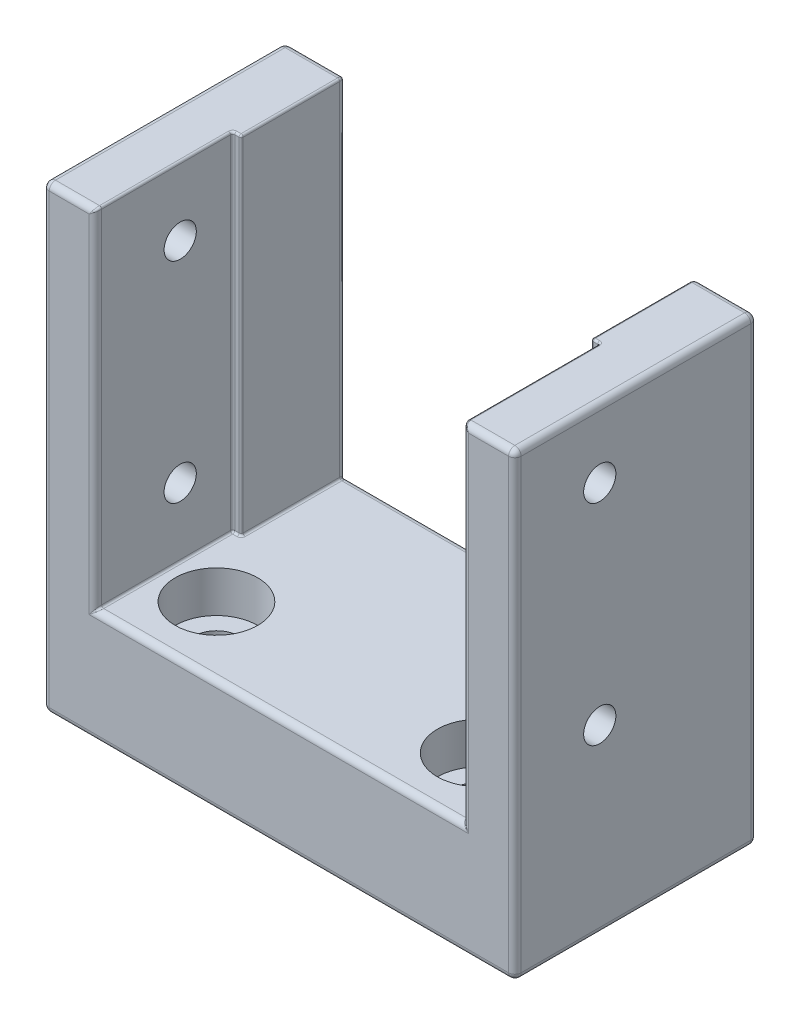
from build123d import *

# Parameters (mm, degrees)
SKETCH1_W                      = 44.45000000000001
SKETCH1_H                      = 29.325011200000002
BOSS_EXTRUDE1_DEPTH            = 13.685012
SKETCH2_W                      = 29.325011200000002
SKETCH2_H                      = 55.6850042
BOSS_EXTRUDE2_DEPTH            = 6.35
M3_5_CLEARANCE_HOLE1_D         = 3.9
SKETCH8_W                      = 12.7
SKETCH8_H                      = 41.9999922
BOSS_EXTRUDE6_DEPTH            = 1.0249910919999998
CBORE_FOR_M5_SHCS1_D           = 5.5
CBORE_FOR_M5_SHCS1_CBORE_D     = 10
CBORE_FOR_M5_SHCS1_CBORE_DEPTH = 5
FILLET1_R                      = 0.762
FILLET2_R                      = 0.254


with BuildPart() as part:
    # Sketch1 → Boss-Extrude1 (new body)
    with BuildSketch(Plane(origin=(0, 0, 0), x_dir=(1, 0, 0), z_dir=(0, 1, 0))):
        Rectangle(SKETCH1_W, SKETCH1_H)
    extrude(amount=-BOSS_EXTRUDE1_DEPTH)

    # Sketch2 → Boss-Extrude2 (add)
    with BuildSketch(Plane(origin=(22.225000000000005, 0, 0), x_dir=(0, 0, -1), z_dir=(1, 0, 0))):
        with Locations((0, 14.1574901)):
            Rectangle(SKETCH2_W, SKETCH2_H)
    boss_extrude2 = extrude(amount=BOSS_EXTRUDE2_DEPTH)

    # M3.5 Clearance Hole1 (through all)
    with Locations(Plane(origin=(28.575000000000003, 0, 0), x_dir=(0, 0, -1), z_dir=(1, 0, 0))):
        with Locations((-4.3874944, 33.7), (-4.3874944, 8.3)):
            m3_5_clearance_hole1 = Hole(M3_5_CLEARANCE_HOLE1_D / 2)

    # Mirror1: Boss-Extrude2, M3.5 Clearance Hole1 across plane
    add(boss_extrude2.mirror(Plane(origin=(0, 0, 0), x_dir=(0, 0, 1), z_dir=(1, 0, 0))))
    add(m3_5_clearance_hole1.mirror(Plane(origin=(0, 0, 0), x_dir=(0, 0, 1), z_dir=(1, 0, 0))), mode=Mode.SUBTRACT)

    # Sketch8 → Boss-Extrude6 (add)
    with BuildSketch(Plane.ZY.offset(-22.225000000000005)):
        with Locations((-8.312505600000001, 20.9999961)):
            Rectangle(SKETCH8_W, SKETCH8_H)
    boss_extrude6 = extrude(amount=BOSS_EXTRUDE6_DEPTH)

    # Mirror2: Boss-Extrude6 across plane
    add(boss_extrude6.mirror(Plane(origin=(0, 0, 0), x_dir=(0, 0, 1), z_dir=(1, 0, 0))))

    # CBORE for M5 SHCS1 (through all)
    with Locations(Plane(origin=(0, 0, 0), x_dir=(1, 0, 0), z_dir=(0, 1, 0))):
        with Locations((15.875, -6.35), (-15.875, -6.35)):
            CounterBoreHole(CBORE_FOR_M5_SHCS1_D / 2, CBORE_FOR_M5_SHCS1_CBORE_D / 2, CBORE_FOR_M5_SHCS1_CBORE_DEPTH)

    # Fillet1
    fillet1_edges = [part.edges().sort_by_distance(p)[0] for p in [
        (-21.200008908000004, 20.9999961, -14.662505600000001),
        (-24.887504454000002, 41.9999922, -14.662505600000001),
        (-28.575000000000003, 14.1574901, -14.662505600000001),
        (28.575000000000003, 14.1574901, -14.662505600000001),
        (24.887504454000002, 41.9999922, -14.662505600000001),
        (21.200008908000004, 20.9999961, -14.662505600000001),
        (0, 0, -14.662505600000001),
        (22.225000000000005, 20.9999961, 14.662505600000001),
        (25.400000000000006, 41.9999922, 14.662505600000001),
        (28.575000000000003, 14.1574901, 14.662505600000001),
        (-28.575000000000003, 14.1574901, 14.662505600000001),
        (-25.400000000000006, 41.9999922, 14.662505600000001),
        (-22.225000000000005, 20.9999961, 14.662505600000001),
        (0, 0, 14.662505600000001),
        (28.575000000000003, -13.685012, 0),
        (0, -13.685012, -14.662505600000001),
        (-28.575000000000003, -13.685012, 0),
        (0, -13.685012, 14.662505600000001),
        (-13.125, -13.685012, 6.349999999999998),
        (18.625, -13.685012, 6.349999999999998),
        (28.575000000000003, 41.9999922, 0),
        (-28.575000000000003, 41.9999922, 0),
    ]]
    fillet(fillet1_edges, radius=FILLET1_R)

    # Fillet2
    fillet2_edges = [part.edges().sort_by_distance(p)[0] for p in [
        (-21.469719640545794, -0.2697107325457889, -14.48213716478083),
        (21.469719640545794, -0.2697107325457889, -14.48213716478083),
        (22.494710732545794, 41.73028146745421, 14.48213716478083),
        (-21.200008908000004, 0, -7.931505600000001),
        (21.200008908000004, 0, -7.931505600000001),
        (22.225000000000005, 41.9999922, 5.968999999999999),
        (-22.494710732545794, -0.2697107325457889, 14.48213716478083),
        (-21.469719640545794, 41.73028146745421, -14.48213716478083),
        (-22.494710732548004, 41.730281467452, 14.4821371647827),
        (22.494710732545794, -0.2697107325457889, 14.48213716478083),
        (21.469719640545794, 41.73028146745421, -14.48213716478083),
        (-22.225000000000005, 0, 5.968999999999999),
        (-21.712504454000005, 0, -1.962505600000001),
        (-21.200008908000004, 41.9999922, -7.9315056),
        (-21.200008908000004, 20.9999961, -1.962505600000001),
        (-22.225000000000005, 20.9999961, -1.962505600000001),
        (-21.712504454000005, 41.9999922, -1.962505600000001),
        (-22.225000000000005, 41.9999922, 5.968999999999999),
        (21.712504454000005, 0, -1.962505600000001),
        (22.225000000000005, 0, 5.968999999999999),
        (21.712504454000005, 41.9999922, -1.962505600000001),
        (21.200008908000004, 20.9999961, -1.962505600000001),
        (22.225000000000005, 20.9999961, -1.962505600000001),
        (21.200008908000004, 41.9999922, -7.9315056),
    ]]
    fillet(fillet2_edges, radius=FILLET2_R)


solid = part.part
